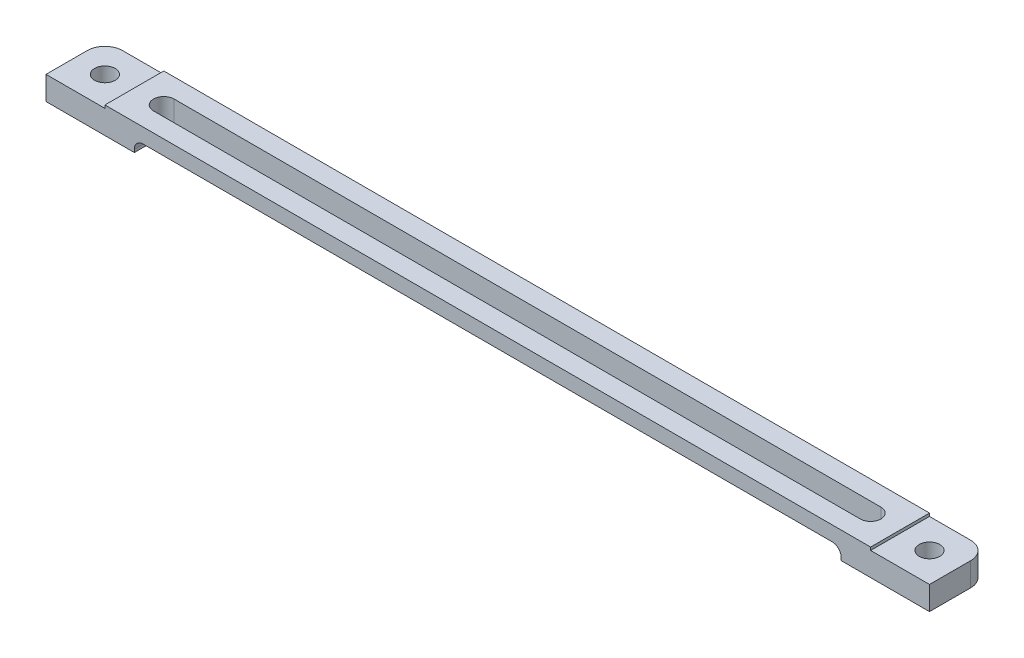
from build123d import *

# Parameters (mm, degrees)
SKETCH1_R           = 1.75
BOSS_EXTRUDE1_DEPTH = 4
SKETCH2_W           = 130
SKETCH2_H           = 10
BOSS_EXTRUDE2_DEPTH = 0.5
CUT_EXTRUDE1_DEPTH  = 2


with BuildPart() as part:
    # Sketch1 → Boss-Extrude1 (new body)
    with BuildSketch(Plane(origin=(0, 0, 0), x_dir=(1, 0, 0), z_dir=(0, 1, 0))):
        with BuildLine():
            ThreePointArc((75, 2), (74.121320344, 4.121320344), (72, 5))
            Line((72, 5), (-72, 5))
            ThreePointArc((-72, 5), (-74.121320344, 4.121320344), (-75, 2))
            Line((-75, 2), (-75, -5))
            Line((-75, -5), (75, -5))
            Line((75, -5), (75, 2))
        make_face()
        with Locations((-70, 0)):
            Circle(SKETCH1_R, mode=Mode.SUBTRACT)
        with BuildLine():
            ThreePointArc((61.75, 0), (61.237436867, -1.237436867), (60, -1.75))
            Line((60, -1.75), (-60, -1.75))
            ThreePointArc((-60, -1.75), (-61.75, 0), (-60, 1.75))
            Line((-60, 1.75), (60, 1.75))
            ThreePointArc((60, 1.75), (61.237436867, 1.237436867), (61.75, 0))
        make_face(mode=Mode.SUBTRACT)
        with Locations((70, 0)):
            Circle(SKETCH1_R, mode=Mode.SUBTRACT)
    extrude(amount=BOSS_EXTRUDE1_DEPTH)

    # Sketch2 → Boss-Extrude2 (add)
    with BuildSketch(Plane(origin=(0, 4, 0), x_dir=(1, 0, 0), z_dir=(0, 1, 0))):
        Rectangle(SKETCH2_W, SKETCH2_H)
        with BuildLine():
            Line((-60, 1.75), (60, 1.75))
            ThreePointArc((60, 1.75), (61.75, 0), (60, -1.75))
            Line((60, -1.75), (-60, -1.75))
            ThreePointArc((-60, -1.75), (-61.75, 0), (-60, 1.75))
        make_face(mode=Mode.SUBTRACT)
    extrude(amount=BOSS_EXTRUDE2_DEPTH)

    # Sketch3 → Cut-Extrude1 (cut)
    with BuildSketch(Plane.XY.offset(5)):
        with BuildLine():
            Line((-58.5, 2), (58.5, 2))
            ThreePointArc((58.5, 2), (59.560660172, 1.560660172), (60, 0.5))
            Line((60, 0.5), (60, 0))
            Line((60, 0), (-60, 0))
            Line((-60, 0), (-60, 0.5))
            ThreePointArc((-60, 0.5), (-59.560660172, 1.560660172), (-58.5, 2))
        make_face()
    extrude(amount=-CUT_EXTRUDE1_DEPTH, mode=Mode.SUBTRACT)


solid = part.part
